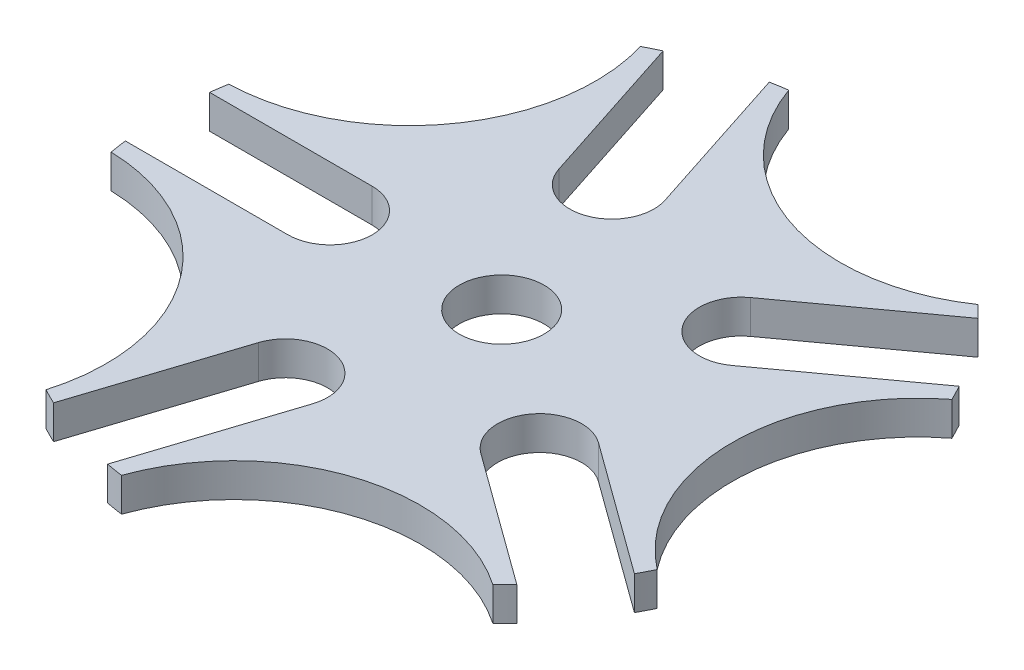
from build123d import *

# Parameters (mm, degrees)
STOCK_PART1_1_DEPTH     = 2.54
CUT_EXTRUDE1_DEPTH      = 36.698530161
CUT_EXTRUDE1_DEPTH_BACK = 36.698530161
SKETCH1_R               = 3.2004


# Read off the part's stored shape, not the designer's step: Stock-Part1-1
with BuildPart() as part:
    # Stock-Part1-1 outline → Stock-Part1-1 (new body)
    with BuildSketch(Plane(origin=(0, 0, 0), x_dir=(1, 0, 0), z_dir=(0, 1, 0))):
        with BuildLine():
            ThreePointArc((-10.807074113, 22.986238255), (-11.381462581, 22.707318413), (-11.948658366, 22.414048346))
            ThreePointArc((-11.948658366, 22.414048346), (-14.055886871, 10.212199581), (-25.009365231, 4.437527549))
            ThreePointArc((-25.009365231, 4.437527549), (-25.113008503, 3.807466867), (-25.200781238, 3.175))
            Line((-25.200781238, 3.175), (-12.941946417, 3.175))
            ThreePointArc((-12.941946417, 3.175), (-9.766946417, 0), (-12.941946417, -3.175))
            Line((-12.941946417, -3.175), (-25.200781238, -3.175))
            ThreePointArc((-25.200781238, -3.175), (-25.113008503, -3.807466867), (-25.009365231, -4.437527549))
            ThreePointArc((-25.009365231, -4.437527549), (-14.055886871, -10.212199581), (-11.948658366, -22.414048346))
            ThreePointArc((-11.948658366, -22.414048346), (-11.381462581, -22.707318413), (-10.807074113, -22.986238255))
            Line((-10.807074113, -22.986238255), (-7.018885822, -11.327393516))
            ThreePointArc((-7.018885822, -11.327393516), (-3.018152425, -9.288918034), (-0.979676944, -13.289651431))
            Line((-0.979676944, -13.289651431), (-4.767865235, -24.948496169))
            ThreePointArc((-4.767865235, -24.948496169), (-4.139230233, -25.060462348), (-3.507979383, -25.156591197))
            ThreePointArc((-3.507979383, -25.156591197), (5.368871043, -16.523686022), (17.624688241, -18.290171252))
            ThreePointArc((17.624688241, -18.290171252), (18.078877786, -17.841361439), (18.521642117, -17.381276515))
            Line((18.521642117, -17.381276515), (8.604036416, -10.175714197))
            ThreePointArc((8.604036416, -10.175714197), (7.901625635, -5.740867064), (12.336472768, -5.038456283))
            Line((12.336472768, -5.038456283), (22.254078469, -12.244018601))
            ThreePointArc((22.254078469, -12.244018601), (22.554823532, -11.680750638), (22.84131474, -11.110100852))
            ThreePointArc((22.84131474, -11.110100852), (17.374031657, 0), (22.84131474, 11.110100852))
            ThreePointArc((22.84131474, 11.110100852), (22.554823532, 11.680750638), (22.254078469, 12.244018601))
            Line((22.254078469, 12.244018601), (12.336472768, 5.038456283))
            ThreePointArc((12.336472768, 5.038456283), (7.901625635, 5.740867064), (8.604036416, 10.175714197))
            Line((8.604036416, 10.175714197), (18.521642117, 17.381276515))
            ThreePointArc((18.521642117, 17.381276515), (18.078877786, 17.841361439), (17.624688241, 18.290171252))
            ThreePointArc((17.624688241, 18.290171252), (5.368871043, 16.523686022), (-3.507979383, 25.156591197))
            ThreePointArc((-3.507979383, 25.156591197), (-4.139230233, 25.060462348), (-4.767865235, 24.948496169))
            Line((-4.767865235, 24.948496169), (-0.979676944, 13.289651431))
            ThreePointArc((-0.979676944, 13.289651431), (-3.018152425, 9.288918034), (-7.018885822, 11.327393516))
            Line((-7.018885822, 11.327393516), (-10.807074113, 22.986238255))
        make_face()
    extrude(amount=STOCK_PART1_1_DEPTH)

    # Sketch1 → Cut-Extrude1 (cut, two sides: drawn at the far end of the back side and taken through both)
    with BuildSketch(Plane(origin=(0, 2.54, 0), x_dir=(1, 0, 0), z_dir=(0, 1, 0)).offset(-CUT_EXTRUDE1_DEPTH_BACK)):
        with Locations(Location((0, 0, 0), (0, 0, 270))):
            Circle(SKETCH1_R)
    extrude(amount=CUT_EXTRUDE1_DEPTH + CUT_EXTRUDE1_DEPTH_BACK, mode=Mode.SUBTRACT)


solid = part.part
